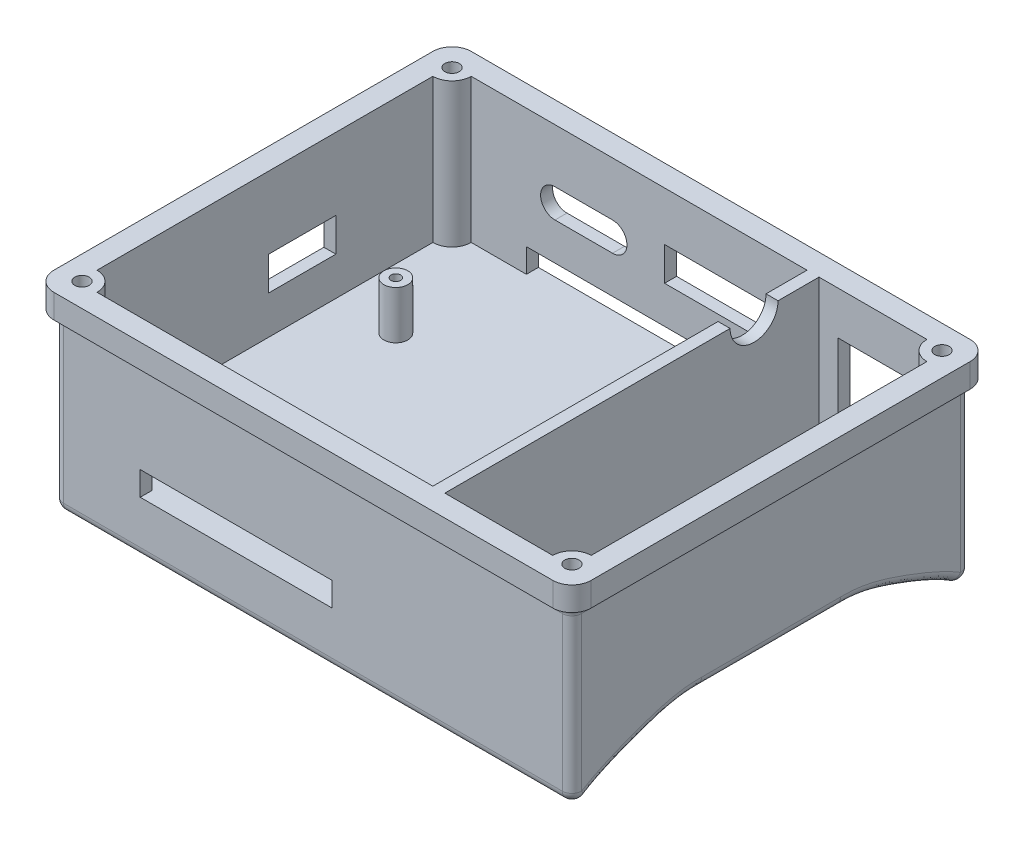
from build123d import *

# Parameters (mm, degrees)
SKETCH1_W            = 105
SKETCH1_H            = 83
SKETCH1_W_2          = 71
SKETCH1_H_2          = 78
SKETCH1_W_3          = 26.5
BOSS_EXTRUDE1_DEPTH  = 30
SKETCH2_W            = 105
SKETCH2_H            = 83
SKETCH2_W_2          = 71
SKETCH2_H_2          = 78
SKETCH2_W_3          = 26.5
BOSS_EXTRUDE2_DEPTH  = 3
SKETCH4_W            = 3
SKETCH4_H            = 83
BOSS_EXTRUDE4_DEPTH  = 33
SKETCH6_W            = 3
SKETCH6_H            = 78
CUT_EXTRUDE2_DEPTH   = 30
SKETCH7_R            = 2.5
SKETCH7_R_2          = 1
BOSS_EXTRUDE5_DEPTH  = 10
SKETCH8_W            = 40
SKETCH8_H            = 5
CUT_EXTRUDE3_DEPTH   = 2.5
SKETCH10_W           = 40
SKETCH10_H           = 5
CUT_EXTRUDE5_DEPTH   = 2.5
CUT_EXTRUDE9_DEPTH   = 2.5
SKETCH12_W           = 22
SKETCH12_H           = 7
CUT_EXTRUDE12_DEPTH  = 2.5
SKETCH13_W           = 14
SKETCH13_H           = 7
CUT_EXTRUDE13_DEPTH  = 2.5
CUT_EXTRUDE15_DEPTH  = 2.5
BOSS_EXTRUDE6_DEPTH  = 20
CUT_EXTRUDE20_START  = -12
CUT_EXTRUDE20_DEPTH  = 12
BOSS_EXTRUDE7_DEPTH  = 30
SKETCH20_R           = 1.5
CUT_EXTRUDE21_DEPTH  = 20
SKETCH31_W           = 108
SKETCH31_H           = 27
BOSS_EXTRUDE11_DEPTH = 10
CUT_EXTRUDE25_START  = -108
CUT_EXTRUDE25_DEPTH  = 108
SKETCH33_W           = 20
SKETCH33_H           = 15
CUT_EXTRUDE26_DEPTH  = 2.5
FILLET8_R            = 2
BOSS_EXTRUDE12_DEPTH = 5
FILLET9_R            = 2


# Read off the part's stored shape, not the designer's step: Cut-Extrude25
with BuildPart() as part:
    # Sketch1 → Boss-Extrude1 (new body)
    with BuildSketch(Plane(origin=(0, 0, 0), x_dir=(1, 0, 0), z_dir=(0, 1, 0))):
        Rectangle(SKETCH1_W, SKETCH1_H)
        with Locations((-14.5, 0)):
            Rectangle(SKETCH1_W_2, SKETCH1_H_2, mode=Mode.SUBTRACT)
        with Locations((36.75, 0)):
            Rectangle(SKETCH1_W_3, SKETCH1_H_2, mode=Mode.SUBTRACT)
    extrude(amount=BOSS_EXTRUDE1_DEPTH)

    # Sketch2 → Boss-Extrude2 (add)
    # profile 1 of 3: a face of its own
    with BuildSketch(Plane.XZ):
        Rectangle(SKETCH2_W, SKETCH2_H)
        with Locations((-14.5, 0)):
            Rectangle(SKETCH2_W_2, SKETCH2_H_2, mode=Mode.SUBTRACT)
        with Locations((36.75, 0)):
            Rectangle(SKETCH2_W_3, SKETCH2_H_2, mode=Mode.SUBTRACT)
    # profile 2 of 3: a face of its own
    with BuildSketch(Plane.XZ):
        with Locations((36.75, 0)):
            Rectangle(SKETCH2_W_3, SKETCH2_H_2)
    # profile 3 of 3: a face of its own
    with BuildSketch(Plane.XZ):
        with Locations((-14.5, 0)):
            Rectangle(SKETCH2_W_2, SKETCH2_H_2)
    extrude(amount=BOSS_EXTRUDE2_DEPTH)

    # Sketch4 → Boss-Extrude4 (add)
    with BuildSketch(Plane.XZ.offset(3)):
        with Locations((-54, 0)):
            Rectangle(SKETCH4_W, SKETCH4_H)
    extrude(amount=-BOSS_EXTRUDE4_DEPTH)

    # Sketch6 → Cut-Extrude2 (cut)
    with BuildSketch(Plane(origin=(0, 30, 0), x_dir=(1, 0, 0), z_dir=(0, 1, 0))):
        with Locations((-51.5, 0)):
            Rectangle(SKETCH6_W, SKETCH6_H)
    extrude(amount=-CUT_EXTRUDE2_DEPTH, mode=Mode.SUBTRACT)

    # Sketch7 → Boss-Extrude5 (add)
    # profile 1 of 4: a face of its own
    with BuildSketch(Plane(origin=(0, 0, 0), x_dir=(1, 0, 0), z_dir=(0, 1, 0))):
        with Locations(Location((-40.5, 14.78, 0), (0, 0, 90))):
            Circle(SKETCH7_R)
        with Locations(Location((-40.5, 14.78, 0), (0, 0, 270))):
            Circle(SKETCH7_R_2, mode=Mode.SUBTRACT)
    # profile 2 of 4: a face of its own
    with BuildSketch(Plane(origin=(0, 0, 0), x_dir=(1, 0, 0), z_dir=(0, 1, 0))):
        with Locations(Location((14.5, 14.78, 0), (0, 0, 90))):
            Circle(SKETCH7_R)
        with Locations(Location((14.5, 14.78, 0), (0, 0, 270))):
            Circle(SKETCH7_R_2, mode=Mode.SUBTRACT)
    # profile 3 of 4: a face of its own
    with BuildSketch(Plane(origin=(0, 0, 0), x_dir=(1, 0, 0), z_dir=(0, 1, 0))):
        with Locations(Location((14.5, -30.22, 0), (0, 0, 90))):
            Circle(SKETCH7_R)
        with Locations(Location((14.5, -30.22, 0), (0, 0, 270))):
            Circle(SKETCH7_R_2, mode=Mode.SUBTRACT)
    # profile 4 of 4: a face of its own
    with BuildSketch(Plane(origin=(0, 0, 0), x_dir=(1, 0, 0), z_dir=(0, 1, 0))):
        with Locations(Location((-40.5, -30.22, 0), (0, 0, 90))):
            Circle(SKETCH7_R)
        with Locations(Location((-40.5, -30.22, 0), (0, 0, 270))):
            Circle(SKETCH7_R_2, mode=Mode.SUBTRACT)
    extrude(amount=BOSS_EXTRUDE5_DEPTH)

    # Sketch8 → Cut-Extrude3 (cut)
    with BuildSketch(Plane.XY.offset(41.5)):
        with Locations((-17.5, 2.5)):
            Rectangle(SKETCH8_W, SKETCH8_H)
    extrude(amount=-CUT_EXTRUDE3_DEPTH, mode=Mode.SUBTRACT)

    # Sketch10 → Cut-Extrude5 (cut)
    with BuildSketch(Plane.XY.offset(-39)):
        with Locations((-17.5, 2.5)):
            Rectangle(SKETCH10_W, SKETCH10_H)
    extrude(amount=-CUT_EXTRUDE5_DEPTH, mode=Mode.SUBTRACT)

    # Sketch11 → Cut-Extrude9 (cut)
    with BuildSketch(Plane(origin=(0, 0, -41.5), x_dir=(-1, 0, 0), z_dir=(0, 0, -1))):
        with BuildLine():
            Line((19.54, 18.79), (31.54, 18.79))
            ThreePointArc((31.54, 18.79), (34.54, 15.79), (31.54, 12.79))
            Line((31.54, 12.79), (19.54, 12.79))
            ThreePointArc((19.54, 12.79), (16.54, 15.79), (19.54, 18.79))
        make_face()
    extrude(amount=-CUT_EXTRUDE9_DEPTH, mode=Mode.SUBTRACT)

    # Sketch12 → Cut-Extrude12 (cut)
    with BuildSketch(Plane(origin=(0, 0, -41.5), x_dir=(-1, 0, 0), z_dir=(0, 0, -1))):
        with Locations((-2.31, 16.29)):
            Rectangle(SKETCH12_W, SKETCH12_H)
    extrude(amount=-CUT_EXTRUDE12_DEPTH, mode=Mode.SUBTRACT)

    # Sketch13 → Cut-Extrude13 (cut)
    with BuildSketch(Plane.ZY.offset(55.5)):
        with Locations((-7.78, 11.5)):
            Rectangle(SKETCH13_W, SKETCH13_H)
    extrude(amount=-CUT_EXTRUDE13_DEPTH, mode=Mode.SUBTRACT)

    # Sketch15 → Cut-Extrude15 (cut)
    with BuildSketch(Plane.ZY.offset(-21)):
        with BuildLine():
            Line((-30.464492786, 30), (-20.464492786, 30))
            ThreePointArc((-20.464492786, 30), (-25.464492786, 25), (-30.464492786, 30))
        make_face()
    extrude(amount=-CUT_EXTRUDE15_DEPTH, mode=Mode.SUBTRACT)

    # Sketch16 → Boss-Extrude6 (add)
    with BuildSketch(Plane(origin=(0, 30, 0), x_dir=(1, 0, 0), z_dir=(0, 1, 0))):
        with BuildLine():
            Line((-53, 35), (-53, 39))
            Line((-53, 39), (-49, 39))
            ThreePointArc((-49, 39), (-50.171572875, 36.171572875), (-53, 35))
        make_face()
        with BuildLine():
            Line((46, 39), (50, 39))
            Line((50, 39), (50, 35))
            ThreePointArc((50, 35), (47.171572875, 36.171572875), (46, 39))
        make_face()
        with BuildLine():
            Line((-53, -35), (-53, -39))
            Line((-53, -39), (-49, -39))
            ThreePointArc((-49, -39), (-50.171572875, -36.171572875), (-53, -35))
        make_face()
        with BuildLine():
            Line((46, -39), (50, -39))
            Line((50, -39), (50, -35))
            ThreePointArc((50, -35), (47.171572875, -36.171572875), (46, -39))
        make_face()
    extrude(amount=-BOSS_EXTRUDE6_DEPTH)

    # Sketch18 → Cut-Extrude20 (cut)
    with BuildSketch(Plane.XZ.offset(-10).offset(CUT_EXTRUDE20_START)):
        with BuildLine():
            Line((50, -35), (50, -39))
            Line((50, -39), (48.5, -39))
            Line((48.5, -39), (46, -39))
            ThreePointArc((46, -39), (47.171572875, -36.171572875), (50, -35))
        make_face()
    extrude(amount=CUT_EXTRUDE20_DEPTH, mode=Mode.SUBTRACT)

    # Sketch19 → Boss-Extrude7 (add)
    with BuildSketch(Plane(origin=(0, 30, 0), x_dir=(1, 0, 0), z_dir=(0, 1, 0))):
        with BuildLine():
            Line((-53, 35), (-53, 39))
            Line((-53, 39), (-49, 39))
            ThreePointArc((-49, 39), (-50.171572875, 36.171572875), (-53, 35))
        make_face()
        with BuildLine():
            Line((-53, -35), (-53, -39))
            Line((-53, -39), (-49, -39))
            ThreePointArc((-49, -39), (-50.171572875, -36.171572875), (-53, -35))
        make_face()
        with BuildLine():
            Line((46, -39), (50, -39))
            Line((50, -39), (50, -35))
            ThreePointArc((50, -35), (47.171572875, -36.171572875), (46, -39))
        make_face()
    extrude(amount=-BOSS_EXTRUDE7_DEPTH)

    # Sketch20 → Cut-Extrude21 (cut)
    with BuildSketch(Plane(origin=(0, 30, 0), x_dir=(1, 0, 0), z_dir=(0, 1, 0))):
        with Locations(Location((-52.57490074, -38.57490074, 0), (0, 0, 270))):
            Circle(SKETCH20_R)
        with Locations(Location((49.57490074, -38.57490074, 0), (0, 0, 270))):
            Circle(SKETCH20_R)
        with Locations(Location((49.57490074, 38.57490074, 0), (0, 0, 270))):
            Circle(SKETCH20_R)
        with Locations(Location((-52.57490074, 38.57490074, 0), (0, 0, 270))):
            Circle(SKETCH20_R)
    extrude(amount=-CUT_EXTRUDE21_DEPTH, mode=Mode.SUBTRACT)

    # Sketch31 → Boss-Extrude11 (add)
    with BuildSketch(Plane.XZ.offset(3)):
        with Locations((-1.5, 28)):
            Rectangle(SKETCH31_W, SKETCH31_H)
        with Locations((-1.5, -28)):
            Rectangle(SKETCH31_W, SKETCH31_H)
    extrude(amount=BOSS_EXTRUDE11_DEPTH)

    # Cut-Extrude25 outline → Cut-Extrude25 (cut)
    with BuildSketch(Plane.ZY.offset(55.5).offset(CUT_EXTRUDE25_START)):
        with BuildLine():
            Line((14.5, -13), (41.5, -13))
            add(Edge.make_bspline(
                [(41.5, -13), (39.406111868, -11.203055934), (36.971409304, -9.489746722), (33.815313388, -8.227308356), (30.478869134, -6.694347482), (27.14242488, -5.612257454), (24.25685147, -4.620341595), (20.649884709, -3), (17.313440455, -3), (14.5, -3)],
                knots=[0, 0, 0, 0, 0, 0, 0, 0, 0, 0, 1, 1, 1, 1, 1, 1, 1, 1, 1, 1], degree=9))
            Line((14.5, -3), (14.5, -13))
        make_face()
        with BuildLine():
            Line((-14.5, -13), (-14.5, -3))
            add(Edge.make_bspline(
                [(-14.5, -3), (-17.313440455, -3), (-20.649884709, -3), (-24.25685147, -4.620341595), (-27.14242488, -5.612257454), (-30.478869134, -6.694347482), (-33.815313388, -8.227308356), (-36.971409304, -9.489746722), (-39.406111868, -11.203055934), (-41.5, -13)],
                knots=[0, 0, 0, 0, 0, 0, 0, 0, 0, 0, 1, 1, 1, 1, 1, 1, 1, 1, 1, 1], degree=9))
            Line((-41.5, -13), (-14.5, -13))
        make_face()
    extrude(amount=CUT_EXTRUDE25_DEPTH, mode=Mode.SUBTRACT)

    # Sketch33 → Cut-Extrude26 (cut)
    with BuildSketch(Plane(origin=(0, 0, -41.5), x_dir=(-1, 0, 0), z_dir=(0, 0, -1))):
        with Locations((-37.5, 13.5)):
            Rectangle(SKETCH33_W, SKETCH33_H)
    extrude(amount=-CUT_EXTRUDE26_DEPTH, mode=Mode.SUBTRACT)

    # Fillet8
    fillet8_edges = [part.edges().sort_by_distance(p)[0] for p in [
        (-55.5, -3, 0),
        (52.5, -3, 0),
        (-1.5, -13, 41.5),
        (-1.5, -13, -41.5),
        (-55.5, -6.213781616, -28.650449254),
        (52.5, -6.213781616, -28.650449254),
        (-55.5, -6.213781616, 28.650449254),
        (52.5, -6.213781616, 28.650449254),
        (-55.5, 8.5, 41.5),
        (-55.5, 8.5, -41.5),
        (52.5, 8.5, -41.5),
        (52.5, 8.5, 41.5),
    ]]
    fillet(fillet8_edges, radius=FILLET8_R)

    # Sketch34 → Boss-Extrude12 (add)
    with BuildSketch(Plane(origin=(0, 30, 0), x_dir=(1, 0, 0), z_dir=(0, 1, 0))):
        with BuildLine():
            Line((54.5, -39.5), (54.5, 39.5))
            ThreePointArc((54.5, 39.5), (53.328427125, 42.328427125), (50.5, 43.5))
            Line((50.5, 43.5), (-53.5, 43.5))
            ThreePointArc((-53.5, 43.5), (-56.328427125, 42.328427125), (-57.5, 39.5))
            Line((-57.5, 39.5), (-57.5, -39.5))
            ThreePointArc((-57.5, -39.5), (-56.328427125, -42.328427125), (-53.5, -43.5))
            Line((-53.5, -43.5), (50.5, -43.5))
            ThreePointArc((50.5, -43.5), (53.328427125, -42.328427125), (54.5, -39.5))
        make_face()
        with BuildLine():
            Line((52.5, -39.5), (52.5, 39.5))
            ThreePointArc((52.5, 39.5), (51.914213562, 40.914213562), (50.5, 41.5))
            Line((50.5, 41.5), (-53.5, 41.5))
            ThreePointArc((-53.5, 41.5), (-54.914213562, 40.914213562), (-55.5, 39.5))
            Line((-55.5, 39.5), (-55.5, -39.5))
            ThreePointArc((-55.5, -39.5), (-54.914213562, -40.914213562), (-53.5, -41.5))
            Line((-53.5, -41.5), (50.5, -41.5))
            ThreePointArc((50.5, -41.5), (51.914213562, -40.914213562), (52.5, -39.5))
        make_face(mode=Mode.SUBTRACT)
    extrude(amount=-BOSS_EXTRUDE12_DEPTH)

    # Fillet9
    fillet9_edges = [part.edges().sort_by_distance(p)[0] for p in [
        (-1.5, 25, 41.5),
        (51.914213562, 25, 40.914213562),
        (52.5, 25, 0),
        (51.914213562, 25, -40.914213562),
        (-1.5, 25, -41.5),
        (-54.914213562, 25, -40.914213562),
        (-55.5, 25, 0),
        (-54.914213562, 25, 40.914213562),
    ]]
    fillet(fillet9_edges, radius=FILLET9_R - 0.0001)  # a hair under: the kernel refuses the full size


solid = part.part
